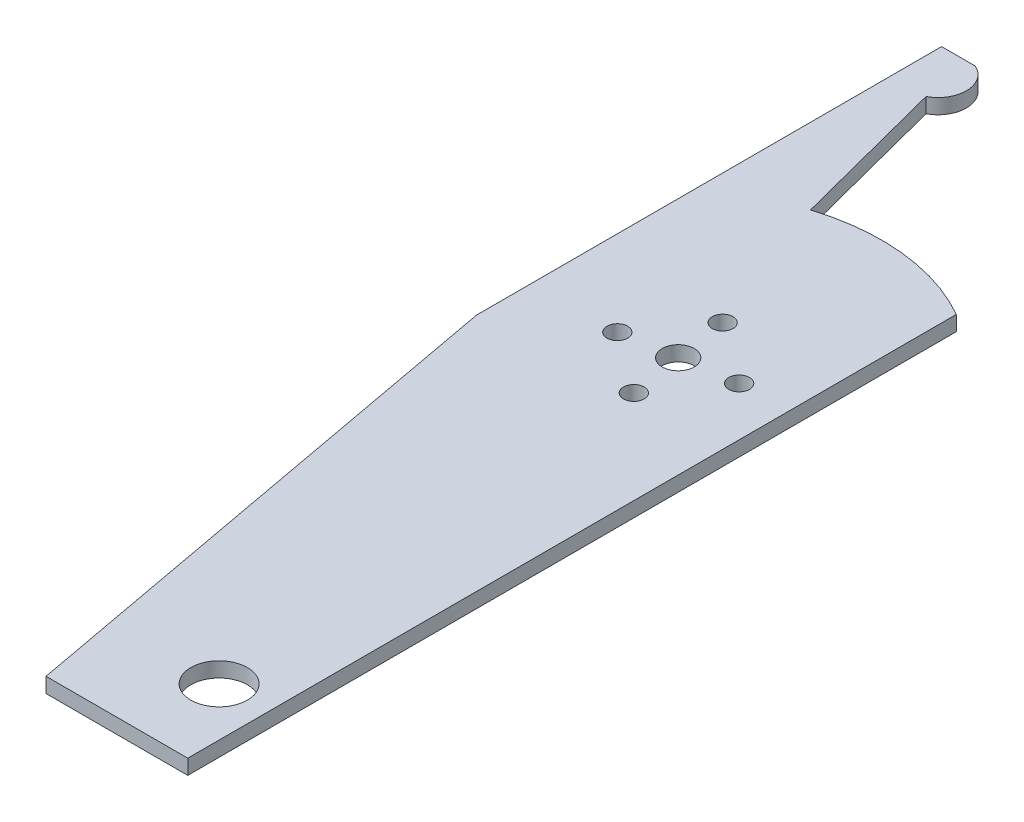
from build123d import *

# Parameters (mm, degrees)
SKETCH1_W           = 50.8
SKETCH1_H           = 210.82
BOSS_EXTRUDE1_DEPTH = 3.175
SKETCH3_R           = 2.2
SKETCH3_R_2         = 3.4
CUT_EXTRUDE1_DEPTH  = 10
SKETCH4_R           = 6
CUT_EXTRUDE2_DEPTH  = 10
CUT_EXTRUDE3_DEPTH  = 10
CUT_EXTRUDE4_DEPTH  = 10


with BuildPart() as part:
    # Sketch1 → Boss-Extrude1 (new body)
    with BuildSketch(Plane(origin=(0, 0, 0), x_dir=(1, 0, 0), z_dir=(0, 1, 0))):
        with Locations((25.4, 105.41)):
            Rectangle(SKETCH1_W, SKETCH1_H)
    extrude(amount=BOSS_EXTRUDE1_DEPTH)

    # Sketch3 → Cut-Extrude1 (cut)
    with BuildSketch(Plane(origin=(0, 3.175, 0), x_dir=(1, 0, 0), z_dir=(0, 1, 0))):
        with Locations((40.436382398, 127.409055369)):
            Circle(SKETCH3_R)
        with Locations((31.011747722, 114.479389432)):
            Circle(SKETCH3_R)
        with Locations((27.506716462, 136.833690045)):
            Circle(SKETCH3_R)
        with Locations((18.082081786, 123.904024108)):
            Circle(SKETCH3_R)
        with Locations((29.24402398, 125.665002942)):
            Circle(SKETCH3_R_2)
    extrude(amount=-CUT_EXTRUDE1_DEPTH, mode=Mode.SUBTRACT)

    # Sketch4 → Cut-Extrude2 (cut)
    with BuildSketch(Plane(origin=(0, 3.175, 0), x_dir=(1, 0, 0), z_dir=(0, 1, 0))):
        with Locations((40.462848215, 16.98892711)):
            Circle(SKETCH4_R)
    extrude(amount=-CUT_EXTRUDE2_DEPTH, mode=Mode.SUBTRACT)

    # Sketch5 → Cut-Extrude3 (cut)
    with BuildSketch(Plane(origin=(0, 0, 0), x_dir=(-1, 0, 0), z_dir=(0, -1, 0))):
        with BuildLine():
            Line((-16.120921706, 166.862226245), (-7.525055385, 199.996914142))
            ThreePointArc((-7.525055385, 199.996914142), (-10.579997408, 206.740664821), (-4.755854581, 211.311245125))
            Line((-4.755854581, 211.311245125), (-7.505915916, 216.509880967))
            Line((-7.505915916, 216.509880967), (-63.327308136, 213.910563046))
            Line((-63.327308136, 213.910563046), (-59.209477183, 156.833875805))
            ThreePointArc((-59.209477183, 156.833875805), (-39.044949923, 167.776389429), (-16.120921706, 166.862226245))
        make_face()
    extrude(amount=-CUT_EXTRUDE3_DEPTH, mode=Mode.SUBTRACT)

    # Sketch2 → Cut-Extrude4 (cut)
    with BuildSketch(Plane(origin=(0, 3.175, 0), x_dir=(1, 0, 0), z_dir=(0, 1, 0))):
        Polygon((20.706614545, 0), (0, 112.090145889), (0, 0), align=None)
    extrude(amount=-CUT_EXTRUDE4_DEPTH, mode=Mode.SUBTRACT)


solid = part.part
